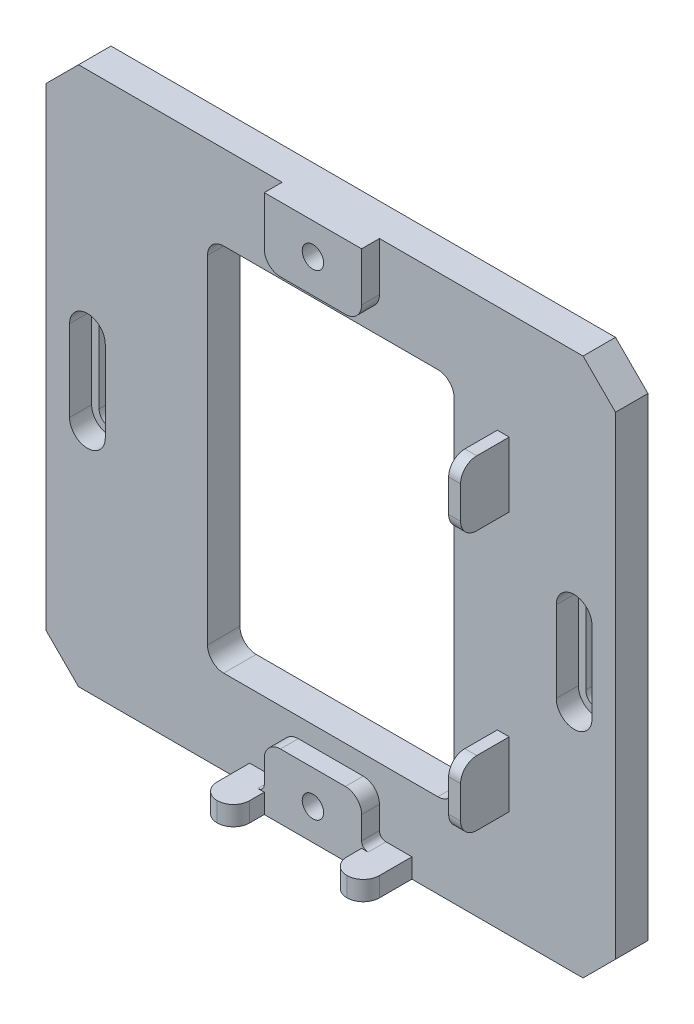
from build123d import *

# Parameters (mm, degrees)
SKETCH_1_W                            = 110
SKETCH_1_H                            = 166
EXTRUDE_1_DEPTH                       = 10
SKETCH_2_W                            = 30
SKETCH_2_H                            = 20
EXTRUDE_2_DEPTH                       = 5.5
HOLE_WIZARD_2_D                       = 6.6
HOLE_WIZARD_2_CBORE_D                 = 11
HOLE_WIZARD_2_CBORE_DEPTH             = 8.8
FILLET_2_R                            = 15
FILLET_3_R                            = 5
SKETCH_9_W                            = 76
SKETCH_9_H                            = 114
CUT_EXTRUDE_1_DEPTH                   = 101.069975517
FILLET_4_R                            = 5
SKETCH_11_W                           = 32.752695491
SKETCH_11_H                           = 40
EXTRUDE_4_DEPTH                       = 10
HOLE_WIZARD_2_2_D                     = 6.4
HOLE_WIZARD_2_2_CBORE_D               = 11
HOLE_WIZARD_2_2_CBORE_DEPTH           = 6.8
HOLE_WIZARD_2_2_ON_FACE_2_D           = 6.4
HOLE_WIZARD_2_2_ON_FACE_2_CBORE_D     = 11
HOLE_WIZARD_2_2_ON_FACE_2_CBORE_DEPTH = 6.8
SKETCH_14_W                           = 11
SKETCH_14_H                           = 25
CUT_EXTRUDE_3_DEPTH                   = 6.8
FILLET_5_R                            = 5
SKETCH_16_W                           = 6.4
SKETCH_16_H                           = 25
CUT_EXTRUDE_5_DEPTH                   = 122.411801593
SKETCH_17_W                           = 10
SKETCH_17_H                           = 15
EXTRUDE_5_DEPTH                       = 5.971999808
EXTRUDE_START                         = -3.675
SKETCH_18_W                           = 15
SKETCH_18_H                           = 20
EXTRUDE_6_DEPTH                       = 3.675
FILLET_6_R                            = 5
FILLET_7_R                            = 2
MM_1_D                                = 4
MM_1_DEPTH                            = 5
MM_1_TIP                              = 1.201721238
CUT_EXTRUDE_6_DEPTH                   = 5
EXTRUDE_START_2                       = -10
EXTRUDE_7_DEPTH                       = 10
CHAMFER_1_SIZE                        = 10


with BuildPart() as part:
    # 草图1 → 凸台-拉伸1 (new body)
    with BuildSketch(Plane.XY):
        Rectangle(SKETCH_1_W, SKETCH_1_H)
    extrude(amount=EXTRUDE_1_DEPTH)

    # 草图2 → 凸台-拉伸2 (add)
    with BuildSketch(Plane.XY.offset(10)):
        with Locations((0, -73)):
            Rectangle(SKETCH_2_W, SKETCH_2_H)
        with Locations((0, 73)):
            Rectangle(SKETCH_2_W, SKETCH_2_H)
    extrude(amount=EXTRUDE_2_DEPTH)

    # Hole Wizard 2 (through all)
    with Locations(Plane(origin=(0, 0, 0), x_dir=(-1, 0, 0), z_dir=(0, 0, -1))):
        with Locations((0, -73.35), (0, 73.35)):
            CounterBoreHole(HOLE_WIZARD_2_D / 2, HOLE_WIZARD_2_CBORE_D / 2, HOLE_WIZARD_2_CBORE_DEPTH)

    # 圆角2
    fillet_2_edges = [part.edges().sort_by_distance(p)[0] for p in [
        (55, -83, 5),
        (-55, -83, 5),
        (-55, 83, 5),
        (55, 83, 5),
    ]]
    fillet(fillet_2_edges, radius=FILLET_2_R)

    # 圆角3
    fillet_3_edges = [part.edges().sort_by_distance(p)[0] for p in [
        (-15, -63, 12.75),
        (15, -63, 12.75),
        (-15, 63, 12.75),
        (15, 63, 12.75),
    ]]
    fillet(fillet_3_edges, radius=FILLET_3_R)

    # 草图9 → 切除-拉伸1 (cut, through all)
    with BuildSketch(Plane.XY.offset(10)):
        Rectangle(SKETCH_9_W, SKETCH_9_H)
    extrude(amount=-CUT_EXTRUDE_1_DEPTH, mode=Mode.SUBTRACT)

    # 圆角4
    fillet_4_edges = [part.edges().sort_by_distance(p)[0] for p in [
        (38, 57, 5),
        (38, -57, 5),
        (-38, -57, 5),
        (-38, 57, 5),
    ]]
    fillet(fillet_4_edges, radius=FILLET_4_R)

    # 草图11 → 凸台-拉伸4 (add)
    with BuildSketch(Plane.XY.offset(10)):
        with Locations((-71.376347745, 0)):
            Rectangle(SKETCH_11_W, SKETCH_11_H)
        with Locations((71.376347745, 0)):
            Rectangle(SKETCH_11_W, SKETCH_11_H)
    extrude(amount=-EXTRUDE_4_DEPTH)

    # Hole Wizard 2 2 (through all)
    with Locations(Plane(origin=(75, -12.5, 10), x_dir=(1, 0, 0), z_dir=(0, 0, 1))):
        with Locations((0, 0), (-150, 25), (-150, 0), (0, 25)):
            CounterBoreHole(HOLE_WIZARD_2_2_D / 2, HOLE_WIZARD_2_2_CBORE_D / 2, HOLE_WIZARD_2_2_CBORE_DEPTH)

    # Hole Wizard 2 2 on face 2 (through all)
    with Locations(Plane(origin=(-121.442232178, 88.770272999, 0), x_dir=(1, 0, 0), z_dir=(0, 0, 1))):
        with Locations((0, 0)):
            CounterBoreHole(HOLE_WIZARD_2_2_ON_FACE_2_D / 2, HOLE_WIZARD_2_2_ON_FACE_2_CBORE_D / 2, HOLE_WIZARD_2_2_ON_FACE_2_CBORE_DEPTH)

    # 草图14 → 切除-拉伸3 (cut)
    with BuildSketch(Plane.XY.offset(10)):
        with Locations((-75, 0)):
            Rectangle(SKETCH_14_W, SKETCH_14_H)
        with Locations((75, 0)):
            Rectangle(SKETCH_14_W, SKETCH_14_H)
    extrude(amount=-CUT_EXTRUDE_3_DEPTH, mode=Mode.SUBTRACT)

    # 圆角5
    fillet_5_edges = [part.edges().sort_by_distance(p)[0] for p in [
        (-87.752695491, 20, 5),
        (-87.752695491, -20, 5),
        (-55, -20, 5),
        (-55, 20, 5),
        (55, -20, 5),
        (87.752695491, -20, 5),
        (87.752695491, 20, 5),
        (55, 20, 5),
    ]]
    fillet(fillet_5_edges, radius=FILLET_5_R)

    # 草图16 → 切除-拉伸5 (cut, through all)
    with BuildSketch(Plane.XY.offset(3.2)):
        with Locations((-75, 0)):
            Rectangle(SKETCH_16_W, SKETCH_16_H)
        with Locations((75, 0)):
            Rectangle(SKETCH_16_W, SKETCH_16_H)
    extrude(amount=-CUT_EXTRUDE_5_DEPTH, mode=Mode.SUBTRACT)

    # 草图17 → 凸台-拉伸5 (add)
    with BuildSketch(Plane(origin=(0, -83, 0), x_dir=(1, 0, 0), z_dir=(0, 1, 0))):
        with Locations((-20, -17.5)):
            Rectangle(SKETCH_17_W, SKETCH_17_H)
        with Locations((20, -17.5)):
            Rectangle(SKETCH_17_W, SKETCH_17_H)
    extrude(amount=EXTRUDE_5_DEPTH)

    # 草图18 → 凸台-拉伸6 (add)
    with BuildSketch(Plane(origin=(55, 0, 0), x_dir=(0, 0, -1), z_dir=(1, 0, 0)).offset(EXTRUDE_START)):
        with Locations((-17.5, 40)):
            Rectangle(SKETCH_18_W, SKETCH_18_H)
        with Locations((-17.5, -40)):
            Rectangle(SKETCH_18_W, SKETCH_18_H)
    extrude(amount=EXTRUDE_6_DEPTH)

    # 圆角6
    fillet_6_edges = [part.edges().sort_by_distance(p)[0] for p in [
        (53.1625, 50, 25),
        (53.1625, 30, 25),
        (53.1625, -30, 25),
        (53.1625, -50, 25),
        (25, -80.014000096, 25),
        (15, -80.014000096, 25),
        (-15, -80.014000096, 25),
        (-25, -80.014000096, 25),
    ]]
    fillet(fillet_6_edges, radius=FILLET_6_R - 0.0001)  # a hair under: the kernel refuses the full size

    # 圆角7
    fillet_7_edges = [part.edges().sort_by_distance(p)[0] for p in [
        (-15, -77.028000192, 12.75),
        (15, -77.028000192, 12.75),
    ]]
    fillet(fillet_7_edges, radius=FILLET_7_R)

    # 大小mm 暗销孔1
    with Locations(Plane(origin=(65, 0, 0), x_dir=(-1, 0, 0), z_dir=(0, 0, -1))):
        with Locations((0, 0)):
            Hole(MM_1_D / 2, depth=MM_1_DEPTH)
            with Locations((0, 0, -(MM_1_DEPTH + MM_1_TIP / 2))):  # 118° drill point
                Cone(0, MM_1_D / 2, MM_1_TIP, mode=Mode.SUBTRACT)

    # 草图21 → 切除-拉伸6 (cut)
    with BuildSketch(Plane(origin=(0, 0, 0), x_dir=(-1, 0, 0), z_dir=(0, 0, -1))):
        with BuildLine():
            Line((65.5, -2), (64.5, -2))
            ThreePointArc((64.5, -2), (62.5, 0), (64.5, 2))
            Line((64.5, 2), (65.5, 2))
            ThreePointArc((65.5, 2), (67.5, 0), (65.5, -2))
        make_face()
    extrude(amount=-CUT_EXTRUDE_6_DEPTH, mode=Mode.SUBTRACT)

    # 草图23 → 凸台-拉伸7 (add)
    with BuildSketch(Plane.XY.offset(10).offset(EXTRUDE_START_2)):
        with BuildLine():
            Line((-40, 83), (-87.752695491, 83))
            Line((-87.752695491, 83), (-87.752695491, 15))
            ThreePointArc((-87.752695491, 15), (-86.288229397, 18.535533906), (-82.752695491, 20))
            Line((-82.752695491, 20), (-60, 20))
            ThreePointArc((-60, 20), (-56.464466094, 21.464466094), (-55, 25))
            Line((-55, 25), (-55, 68))
            ThreePointArc((-55, 68), (-50.606601718, 78.606601718), (-40, 83))
        make_face()
        with BuildLine():
            ThreePointArc((-82.752695491, -20), (-86.288229397, -18.535533906), (-87.752695491, -15))
            Line((-87.752695491, -15), (-87.752695491, -83))
            Line((-87.752695491, -83), (-40, -83))
            ThreePointArc((-40, -83), (-50.606601718, -78.606601718), (-55, -68))
            Line((-55, -68), (-55, -25))
            ThreePointArc((-55, -25), (-56.464466094, -21.464466094), (-60, -20))
            Line((-60, -20), (-82.752695491, -20))
        make_face()
        with BuildLine():
            Line((87.752695491, -83), (87.752695491, -15))
            ThreePointArc((87.752695491, -15), (86.288229397, -18.535533906), (82.752695491, -20))
            Line((82.752695491, -20), (60, -20))
            ThreePointArc((60, -20), (56.464466094, -21.464466094), (55, -25))
            Line((55, -25), (55, -30))
            Line((55, -30), (51.324999949, -30))
            Line((51.324999949, -30), (51.324999949, -50))
            Line((51.324999949, -50), (55, -50))
            Line((55, -50), (55, -68))
            ThreePointArc((55, -68), (50.606601718, -78.606601718), (40, -83))
            Line((40, -83), (87.752695491, -83))
        make_face()
        with BuildLine():
            Line((87.752695491, 83), (40, 83))
            ThreePointArc((40, 83), (50.606601718, 78.606601718), (55, 68))
            Line((55, 68), (55, 50))
            Line((55, 50), (51.324999949, 50))
            Line((51.324999949, 50), (51.324999949, 30))
            Line((51.324999949, 30), (55, 30))
            Line((55, 30), (55, 25))
            ThreePointArc((55, 25), (56.464466094, 21.464466094), (60, 20))
            Line((60, 20), (82.752695491, 20))
            ThreePointArc((82.752695491, 20), (86.288229397, 18.535533906), (87.752695491, 15))
            Line((87.752695491, 15), (87.752695491, 83))
        make_face()
    extrude(amount=EXTRUDE_7_DEPTH)

    # 倒角1
    chamfer_1_edges = [part.edges().sort_by_distance(p)[0] for p in [
        (-87.752695491, 83, 5),
        (-87.752695491, -83, 5),
        (87.752695491, -83, 5),
        (87.752695491, 83, 5),
    ]]
    chamfer(chamfer_1_edges, length=CHAMFER_1_SIZE)


solid = part.part
